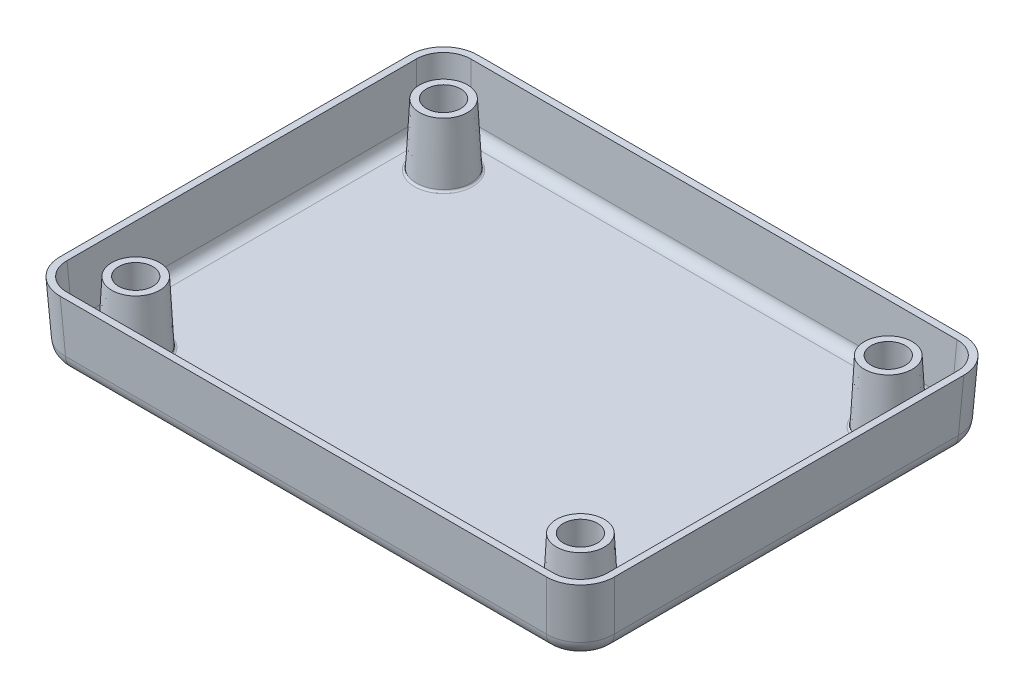
from build123d import *

# Parameters (mm, degrees)
BOSS_W          = 101.6
BOSS_H          = 76.2
BOSS_R          = 6.35
MAIN_BOSS_DEPTH = 25.4
DRAFT1_ANGLE    = 3
DRAFT2_ANGLE    = -3
FILLET1_R       = 12.7
FILLET2_R       = 6.35
SHELL1_T        = -2.54
FILLET3_R       = 0.762
FILLET4_R       = 0.762


with BuildPart() as part:
    # BOSS → MAIN_BOSS (new body)
    with BuildSketch(Plane(origin=(0, 0, 0), x_dir=(1, 0, 0), z_dir=(0, 1, 0))):
        with Locations((50.8, 38.1)):
            Rectangle(BOSS_W, BOSS_H)
        with Locations(Location((82.55, 57.15, 0), (0, 0, 270))):
            Circle(BOSS_R, mode=Mode.SUBTRACT)
    extrude(amount=MAIN_BOSS_DEPTH)

    # Draft1
    draft1_faces = [part.faces().sort_by_distance(p)[0] for p in [
        (50.8, 12.7, -76.2),
        (101.6, 12.7, -38.1),
    ]]
    draft(draft1_faces, Plane(origin=(0, 0, 0), x_dir=(0, 0, -1), z_dir=(0, -1, 0)), DRAFT1_ANGLE)

    # Draft2
    draft2_faces = [part.faces().sort_by_distance(p)[0] for p in [
        (82.55, 12.7, -63.5),
    ]]
    draft(draft2_faces, Plane.ZX.offset(25.4), DRAFT2_ANGLE)

    # Fillet1
    fillet1_edges = [part.edges().sort_by_distance(p)[0] for p in [
        (102.265578797, 12.7, -76.865578797),
    ]]
    fillet(fillet1_edges, radius=FILLET1_R)

    # Fillet2
    fillet2_edges = [part.edges().sort_by_distance(p)[0] for p in [
        (44.458702454, 0, -76.2),
        (97.887458497, 0, -72.487458497),
        (101.6, 0, -31.758702454),
    ]]
    fillet(fillet2_edges, radius=FILLET2_R)

    # Shell1
    shell1_openings = [part.faces().sort_by_distance(p)[0] for p in [
        (50.747485491, 25.4, -38.309249016),
        (50.988163553, 12.761210563, 0),
        (0, 12.781516987, -38.290149163),
    ]]
    offset(amount=SHELL1_T, openings=shell1_openings, kind=Kind.INTERSECTION)

    # Fillet3
    fillet3_edges = [part.edges().sort_by_distance(p)[0] for p in [
        (82.55, 2.54, -67.241527593),
    ]]
    fillet(fillet3_edges, radius=FILLET3_R)

    # Fillet4
    fillet4_edges = [part.edges().sort_by_distance(p)[0] for p in [
        (82.55, 0, -64.831157594),
    ]]
    fillet(fillet4_edges, radius=FILLET4_R)

    # Mirror1: part across plane


with BuildPart() as part_1:
    add(part.part)
    add(part.part.mirror(Plane(origin=(0, 25.4, 0), x_dir=(0, 0, 1), z_dir=(1, 0, 0))))

    # Mirror2: part across face


with BuildPart() as part_2:
    add(part_1.part)
    add(part_1.part.mirror(Plane(origin=(0, 3.657675059, 0), x_dir=(1, 0, 0), z_dir=(0, 0, 1))))


solid = part_2.part
